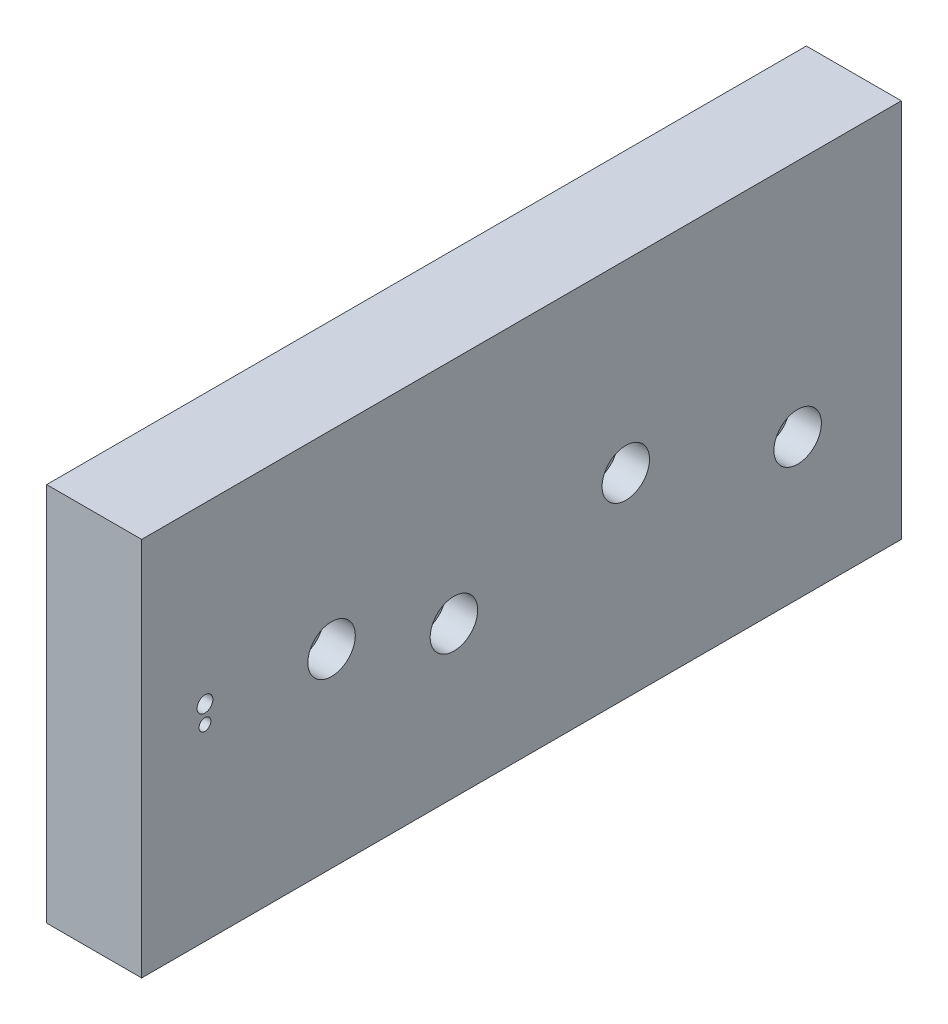
from build123d import *

# Parameters (mm, degrees)
SKETCH1_W                       = 152.4
SKETCH1_H                       = 76.2
SKETCH1_R                       = 1.5875
SKETCH1_R_2                     = 1.190625
BOSS_EXTRUDE1_DEPTH             = 19.05
SKETCH3_R                       = 4.7625
CUT_EXTRUDE2_DEPTH              = 6.35
F_1_4_0_25_DIAMETER_HOLE1_D     = 6.35
F_1_4_0_25_DIAMETER_HOLE1_DEPTH = 12.7
F_1_4_0_25_DIAMETER_HOLE1_TIP   = 1.907732465
CUT_EXTRUDE1_START              = -6.35
SKETCH2_R                       = 4.7625
CUT_EXTRUDE1_DEPTH              = 6.35


with BuildPart() as part:
    # Sketch1 → Boss-Extrude1 (new body)
    with BuildSketch(Plane(origin=(0, 0, 0), x_dir=(0, 0, -1), z_dir=(1, 0, 0))):
        Rectangle(SKETCH1_W, SKETCH1_H)
        with Locations((20.927, 1.096077564)):
            Circle(SKETCH1_R, mode=Mode.SUBTRACT)
        with Locations((-38.1, 0)):
            Circle(SKETCH1_R, mode=Mode.SUBTRACT)
        with Locations((-63.5, 3.175)):
            Circle(SKETCH1_R, mode=Mode.SUBTRACT)
        with Locations((55.404, -9.873506796)):
            Circle(SKETCH1_R, mode=Mode.SUBTRACT)
        with Locations((-13.55, -7.860160556)):
            Circle(SKETCH1_R, mode=Mode.SUBTRACT)
        with Locations((-63.5, -0.396875)):
            Circle(SKETCH1_R_2, mode=Mode.SUBTRACT)
    extrude(amount=BOSS_EXTRUDE1_DEPTH)

    # Sketch3 → Cut-Extrude2 (cut)
    with BuildSketch(Plane(origin=(19.05, 0, 0), x_dir=(0, 0, -1), z_dir=(1, 0, 0))):
        with Locations((-38.1, 0)):
            Circle(SKETCH3_R)
        with Locations((-13.55, -7.860160556)):
            Circle(SKETCH3_R)
        with Locations((20.927, 1.096077564)):
            Circle(SKETCH3_R)
        with Locations((55.404, -9.873506796)):
            Circle(SKETCH3_R)
    extrude(amount=-CUT_EXTRUDE2_DEPTH, mode=Mode.SUBTRACT)

    # 1/4 (0.25) Diameter Hole1
    with Locations(Plane.XZ.offset(38.1)):
        with Locations((9.525, 57.15), (9.525, 0), (9.525, -63.5)):
            Hole(F_1_4_0_25_DIAMETER_HOLE1_D / 2, depth=F_1_4_0_25_DIAMETER_HOLE1_DEPTH)
            with Locations((0, 0, -(F_1_4_0_25_DIAMETER_HOLE1_DEPTH + F_1_4_0_25_DIAMETER_HOLE1_TIP / 2))):  # 118° drill point
                Cone(0, F_1_4_0_25_DIAMETER_HOLE1_D / 2, F_1_4_0_25_DIAMETER_HOLE1_TIP, mode=Mode.SUBTRACT)

    # Sketch2 → Cut-Extrude1 (cut)
    with BuildSketch(Plane.ZY.offset(CUT_EXTRUDE1_START)):
        with Locations((38.1, 0)):
            Circle(SKETCH2_R)
        with Locations((22.202, 0)):
            Circle(SKETCH2_R)
        with Locations((-12.275, 0)):
            Circle(SKETCH2_R)
        with Locations((-46.752, 0)):
            Circle(SKETCH2_R)
    extrude(amount=CUT_EXTRUDE1_DEPTH, mode=Mode.SUBTRACT)


solid = part.part
